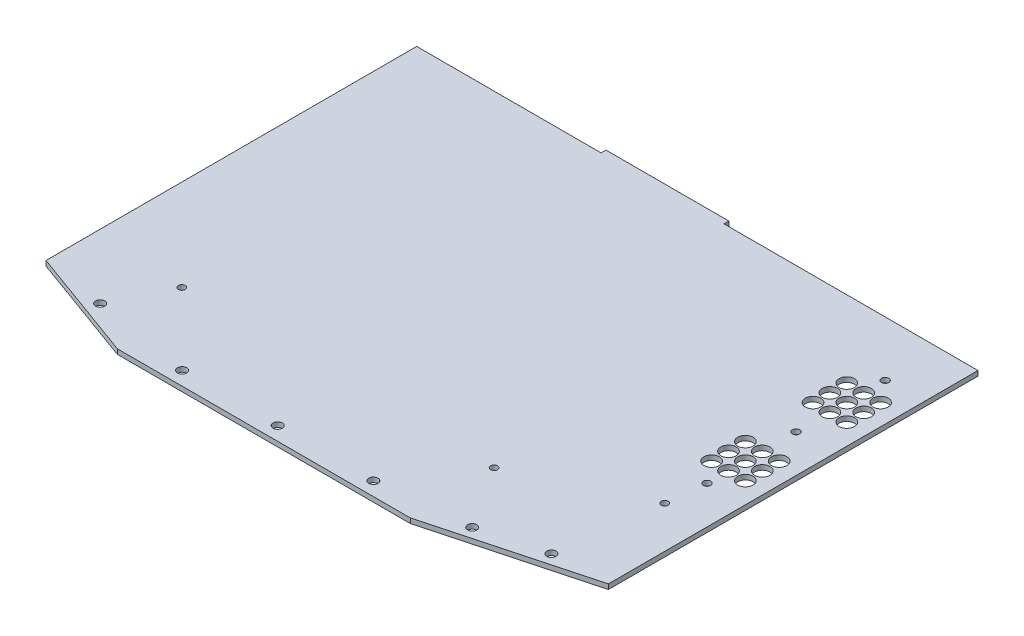
from build123d import *

# Parameters (mm, degrees)
SKETCH1_W               = 308.08168
SKETCH1_H               = 3.175
BOSS_EXTRUDE1_DEPTH     = 267.83
SKETCH3_W               = 267.83
SKETCH3_H               = 3.175
BOSS_EXTRUDE3_DEPTH     = 3.175
SKETCH4_W               = 50.8889
SKETCH4_H               = 3.175
BOSS_EXTRUDE4_DEPTH     = 267.83
CUT_EXTRUDE1_DEPTH      = 340.191055801
CUT_EXTRUDE3_DEPTH      = 340.191055801
SKETCH17_W              = 242.43
SKETCH17_H              = 3.175
BOSS_EXTRUDE5_DEPTH     = 3.175
CUT_EXTRUDE7_DEPTH      = 340.191055801
CUT_EXTRUDE7_DEPTH_BACK = 340.191055801
SKETCH25_R              = 3
CUT_EXTRUDE8_DEPTH      = 3.175
SKETCH27_R              = 5
CUT_EXTRUDE9_DEPTH      = 340.191055801
M4_CLEARANCE_HOLE1_D    = 4.5
SKETCH30_W              = 80
SKETCH30_H              = 3.175
BOSS_EXTRUDE6_DEPTH     = 3.175
SKETCH31_R              = 2.4
CUT_EXTRUDE10_DEPTH     = 340.191055801
LPATTERN1_COUNT         = 3
LPATTERN1_PITCH         = 58


with BuildPart() as part:
    # Sketch1 → Boss-Extrude1 (new body)
    with BuildSketch(Plane.XY):
        Rectangle(SKETCH1_W, SKETCH1_H)
    extrude(amount=BOSS_EXTRUDE1_DEPTH)

    # Sketch3 → Boss-Extrude3 (add)
    with BuildSketch(Plane(origin=(154.04084, 0, 0), x_dir=(0, 0, -1), z_dir=(1, 0, 0))):
        with Locations((-133.915, 0)):
            Rectangle(SKETCH3_W, SKETCH3_H)
    extrude(amount=BOSS_EXTRUDE3_DEPTH)

    # Sketch4 → Boss-Extrude4 (add)
    with BuildSketch(Plane.XY.offset(267.83)):
        with Locations((182.66029, 0)):
            Rectangle(SKETCH4_W, SKETCH4_H)
    extrude(amount=-BOSS_EXTRUDE4_DEPTH)

    # Sketch6 → Cut-Extrude1 (cut, through all)
    with BuildSketch(Plane(origin=(0, 1.5875, 0), x_dir=(1, 0, 0), z_dir=(0, 1, 0))):
        Polygon((208.10474, -240.606362049), (106.50474, -267.83), (208.10474, -267.83), align=None)
    extrude(amount=-CUT_EXTRUDE1_DEPTH, mode=Mode.SUBTRACT)

    # Sketch11 → Cut-Extrude3 (cut, through all)
    with BuildSketch(Plane.XZ.offset(1.5875)):
        Polygon((-154.04084, 242.43), (-84.19084, 267.83), (-154.04084, 267.83), align=None)
    extrude(amount=-CUT_EXTRUDE3_DEPTH, mode=Mode.SUBTRACT)

    # Sketch17 → Boss-Extrude5 (add)
    with BuildSketch(Plane.ZY.offset(154.04084)):
        with Locations((121.215, 0)):
            Rectangle(SKETCH17_W, SKETCH17_H)
    extrude(amount=BOSS_EXTRUDE5_DEPTH)

    # Sketch23 → Cut-Extrude7 (cut, two sides: drawn at the far end of the back side and taken through both)
    with BuildSketch(Plane(origin=(0, 1.5875, 0), x_dir=(1, 0, 0), z_dir=(0, 1, 0)).offset(-CUT_EXTRUDE7_DEPTH_BACK)):
        Polygon((678.249083806, -545.080881384), (-154.04084, -242.43), (-157.21584, -241.275454545), (-989.505763806, 61.375426839), (-1594.807526575, -1603.204420774), (72.947321038, -2209.660728997), align=None)
    extrude(amount=CUT_EXTRUDE7_DEPTH + CUT_EXTRUDE7_DEPTH_BACK, mode=Mode.SUBTRACT)

    # Sketch25 → Cut-Extrude8 (cut)
    with BuildSketch(Plane.XZ.offset(1.5875)):
        with Locations((-115.3206, 247.910027091)):
            Circle(SKETCH25_R)
        with Locations((-50.97526, 258.94)):
            Circle(SKETCH25_R)
        with Locations((11.25474, 258.94)):
            Circle(SKETCH25_R)
        with Locations((73.48474, 258.94)):
            Circle(SKETCH25_R)
        with Locations((172.54474, 242.09298883)):
            Circle(SKETCH25_R)
        with Locations((131.90474, 252.982444011)):
            Circle(SKETCH25_R)
    extrude(amount=-CUT_EXTRUDE8_DEPTH, mode=Mode.SUBTRACT)

    # Sketch27 → Cut-Extrude9 (cut, through all)
    with BuildSketch(Plane.XZ.offset(1.5875)):
        with Locations((172.48674, 137.774823778)):
            Circle(SKETCH27_R)
        with Locations((183.48674, 137.774823778)):
            Circle(SKETCH27_R)
        with Locations((194.48674, 137.774823778)):
            Circle(SKETCH27_R)
        with Locations((194.48674, 126.774823778)):
            Circle(SKETCH27_R)
        with Locations((194.48674, 115.774823778)):
            Circle(SKETCH27_R)
        with Locations((183.48674, 126.774823778)):
            Circle(SKETCH27_R)
        with Locations((183.48674, 115.774823778)):
            Circle(SKETCH27_R)
        with Locations((172.48674, 115.774823778)):
            Circle(SKETCH27_R)
        with Locations((172.48674, 126.774823778)):
            Circle(SKETCH27_R)
        with Locations((194.48674, 71.774823778)):
            Circle(SKETCH27_R)
        with Locations((194.48674, 60.774823778)):
            Circle(SKETCH27_R)
        with Locations((194.48674, 49.774823778)):
            Circle(SKETCH27_R)
        with Locations((183.48674, 71.774823778)):
            Circle(SKETCH27_R)
        with Locations((183.48674, 60.774823778)):
            Circle(SKETCH27_R)
        with Locations((183.48674, 49.774823778)):
            Circle(SKETCH27_R)
        with Locations((172.48674, 49.774823778)):
            Circle(SKETCH27_R)
        with Locations((172.48674, 60.774823778)):
            Circle(SKETCH27_R)
        with Locations((172.48674, 71.774823778)):
            Circle(SKETCH27_R)
    extrude(amount=-CUT_EXTRUDE9_DEPTH, mode=Mode.SUBTRACT)

    # M4 Clearance Hole1 (through all)
    with Locations(Plane.XZ.offset(1.5875)):
        with Locations((105.42905, 212.2849914), (-97.77095, 212.2849914), (180.96500002, 176.776)):
            Hole(M4_CLEARANCE_HOLE1_D / 2)

    # Sketch30 → Boss-Extrude6 (add)
    with BuildSketch(Plane(origin=(0, 0, 0), x_dir=(-1, 0, 0), z_dir=(0, 0, -1))):
        with Locations((-2.78399998, 0)):
            Rectangle(SKETCH30_W, SKETCH30_H)
    extrude(amount=BOSS_EXTRUDE6_DEPTH)

    # Sketch31 → Cut-Extrude10 (cut, symmetric)
    with BuildSketch(Plane.XZ.offset(1.5875)):
        with Locations((183.48674, 151.774823778)):
            Circle(SKETCH31_R)
    cut_extrude10 = extrude(amount=CUT_EXTRUDE10_DEPTH, both=True, mode=Mode.SUBTRACT)

    # LPattern1: Cut-Extrude10 ×3
    with Locations(*[(0, 0, -i * LPATTERN1_PITCH) for i in range(1, LPATTERN1_COUNT)]):
        add(cut_extrude10, mode=Mode.SUBTRACT)


solid = part.part
